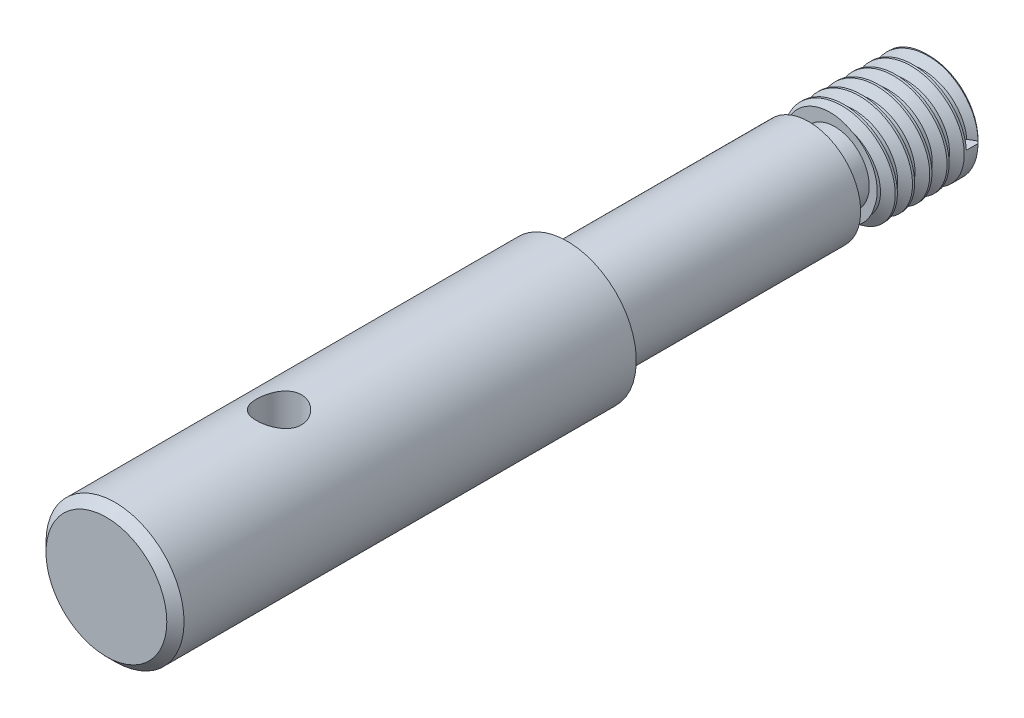
from build123d import *

# Parameters (mm, degrees)
CROQUIS1_R                 = 4
SALIENTE_EXTRUIR1_DEPTH    = 46.705
CROQUIS2_R                 = 1.3
CORTAR_EXTRUIR1_DEPTH      = 48.553727772
CROQUIS3_R                 = 4
CROQUIS3_R_2               = 3
CORTAR_EXTRUIR2_DEPTH      = 25
CROQUIS8_W                 = 20
CROQUIS8_H                 = 4
CORTAR_EXTRUIR3_DEPTH      = 48.553727895
CROQUIS9_R                 = 4
SALIENTE_EXTRUIR2_DEPTH    = 5
CHAFL_N1_SIZE              = 0.5
ROSCA2_PITCH               = 1
CORTAR_EXTRUIR4_DEPTH      = 0.5
CORTAR_EXTRUIR4_DEPTH_BACK = 1
CROQUIS13_R                = 6.495450524
CROQUIS13_R_2              = 2


with BuildPart() as part:
    # Croquis1 → Saliente-Extruir1 (new body)
    with BuildSketch(Plane.XY):
        Circle(CROQUIS1_R)
    extrude(amount=SALIENTE_EXTRUIR1_DEPTH)

    # Croquis2 → Cortar-Extruir1 (cut, through all)
    with BuildSketch(Plane(origin=(0, 4, 0), x_dir=(1, 0, 0), z_dir=(0, 1, 0))):
        with Locations(Location((0, -41.705, 0), (0, 0, 270))):
            Circle(CROQUIS2_R)
    extrude(amount=-CORTAR_EXTRUIR1_DEPTH, mode=Mode.SUBTRACT)

    # Croquis3 → Cortar-Extruir2 (cut)
    with BuildSketch(Plane(origin=(0, 0, 0), x_dir=(-1, 0, 0), z_dir=(0, 0, -1))):
        Circle(CROQUIS3_R)
        Circle(CROQUIS3_R_2, mode=Mode.SUBTRACT)
    extrude(amount=-CORTAR_EXTRUIR2_DEPTH, mode=Mode.SUBTRACT)

    # Croquis8 → Cortar-Extruir3 (cut, through all)
    with BuildSketch(Plane(origin=(0, 4, 0), x_dir=(1, 0, 0), z_dir=(0, 1, 0))):
        with Locations((0, -2)):
            Rectangle(CROQUIS8_W, CROQUIS8_H)
    extrude(amount=-CORTAR_EXTRUIR3_DEPTH, mode=Mode.SUBTRACT)

    # Croquis9 → Saliente-Extruir2 (add)
    with BuildSketch(Plane.XY.offset(46.705)):
        with Locations(Location((0, 0, 0), (0, 0, 180))):
            Circle(CROQUIS9_R)
    extrude(amount=SALIENTE_EXTRUIR2_DEPTH)

    # Chaflán1
    chafl_n1_edges = [part.edges().sort_by_distance(p)[0] for p in [
        (4, 0, 51.705),
    ]]
    chamfer(chafl_n1_edges, length=CHAFL_N1_SIZE)

    # Rosca2: arcs per turn and ends read off the stored shape
    # Rosca2: the profile of Perfil de rosca2 profile screwed along a right-hand helix through 6 turns, 8 arcs to a turn; built about Z, then put on its axis
    rosca2_z = Axis((0, 0, 0), (0, 0, 1))
    rosca2_corners = [(3.0003, 0, -0.000173205), (3.0003, 0, 0.875173202), (2.458734125, 0, 0.562499999), (2.458734125, 0, 0.312499999)]
    with BuildLine(mode=Mode.PRIVATE) as rosca2_profile:
        Line(rosca2_corners[0], rosca2_corners[1])
        Line(rosca2_corners[1], rosca2_corners[2])
        Line(rosca2_corners[2], rosca2_corners[3])
        Line(rosca2_corners[3], rosca2_corners[0])
    rosca2_cap = Face(rosca2_profile.wire())
    rosca2_turn_angles = [0, 22.5, 45, 67.5, 90, 112.5, 135, 157.5, 180, 202.5, 225, 247.5, 270, 292.5, 315, 337.5, 360]
    rosca2_turn_weights = [1, 0.9238795325112867, 1, 0.9238795325112867, 1, 0.9238795325112867, 1, 0.9238795325112867, 1, 0.9238795325112867, 1, 0.9238795325112867, 1, 0.9238795325112867, 1, 0.9238795325112867, 1]
    rosca2_turn_rails = [Edge.make_bspline([Vector(p[0], p[1], 0).rotate(rosca2_z, rosca2_turn_angles[k]) / rosca2_turn_weights[k] + Vector(0, 0, p[2] + ROSCA2_PITCH * rosca2_turn_angles[k] / 360) for k in range(17)], [0, 0, 0, 1, 1, 2, 2, 3, 3, 4, 4, 5, 5, 6, 6, 7, 7, 8, 8, 8], 2, rosca2_turn_weights) for p in rosca2_corners]
    rosca2_turn_sides = [Face.make_surface_from_curves(rosca2_turn_rails[p[0]], rosca2_turn_rails[p[1]]) for p in [(0, 1), (1, 2), (2, 3), (3, 0)]]
    rosca2 = Plane(origin=(0, 0, 4), x_dir=(1, 0, 0), z_dir=(0, 0, 1)) * Solid(Shell([*[p.moved(Location((0, 0, ROSCA2_PITCH * i))) for i in range(6) for p in rosca2_turn_sides], rosca2_cap, rosca2_cap.rotate(rosca2_z, 2160).moved(Location((0, 0, ROSCA2_PITCH * 2160 / 360)))]))
    add(rosca2, mode=Mode.SUBTRACT)

    # Chaflán2: read off the stored shape, not the designer's step
    # Chaflán2 outline → Chaflán2 (revolve, cut)
    with BuildSketch(Plane.XZ):
        Polygon((3, 4.2), (2.8, 4), (3, 4), align=None)
    revolve(axis=Axis((0, 0, 0), (0, 0, 1)), mode=Mode.SUBTRACT)

    # Croquis13 → Cortar-Extruir4 (cut, two sides: drawn at the far end of the back side and taken through both)
    with BuildSketch(Plane(origin=(0, 0, 10), x_dir=(-1, 0, 0), z_dir=(0, 0, -1)).offset(-CORTAR_EXTRUIR4_DEPTH_BACK)):
        Circle(CROQUIS13_R)
        Circle(CROQUIS13_R_2, mode=Mode.SUBTRACT)
    extrude(amount=CORTAR_EXTRUIR4_DEPTH + CORTAR_EXTRUIR4_DEPTH_BACK, mode=Mode.SUBTRACT)


solid = part.part
